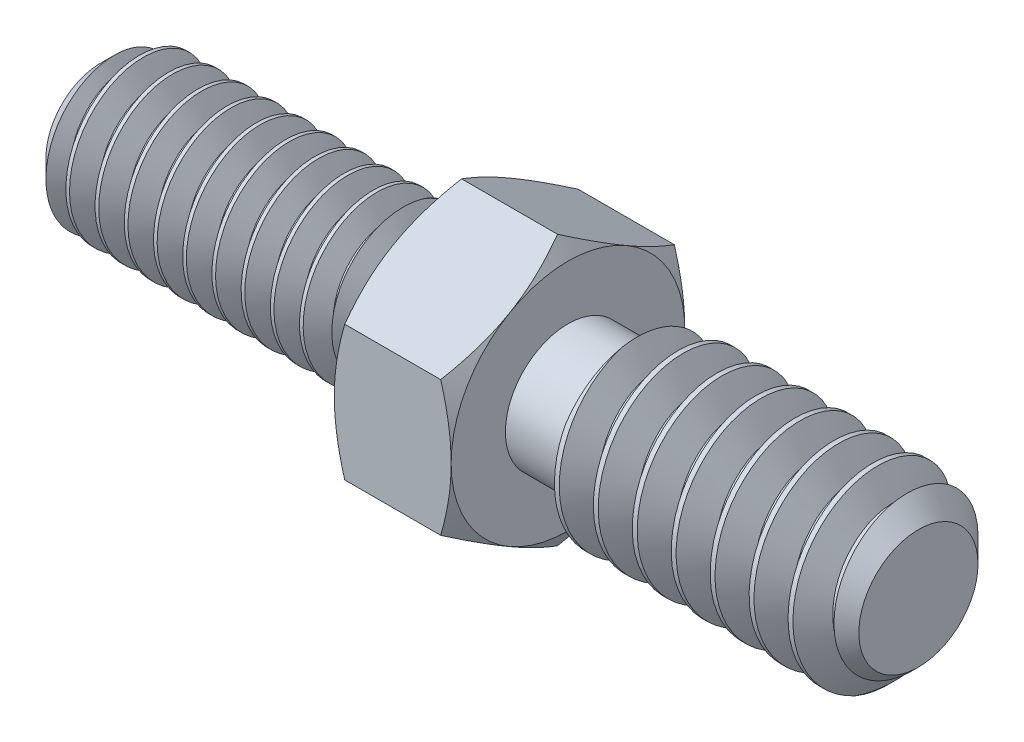
from build123d import *

# Parameters (mm, degrees)
SKETCH2_R           = 2.0828
EXTRUDE1_DEPTH      = 11.1125
CHAMFER1_SIZE       = 0.5953125
CUT_SWEEP3_PITCH    = 0.79375
SKETCH11_W          = 2.74240625
SKETCH11_H          = 0.566355748
SKETCH19_OUTSIDE_W  = 42.884
SKETCH19_OUTSIDE_H  = 42.884
SKETCH19_OUTSIDE_R  = 1.516444252
EXTRUDE10_DEPTH     = 9.873251015
EXTRUDE10_DRAFT     = -60
SKETCH3_R           = 2.413
EXTRUDE2_DEPTH      = 11.1125
CHAMFER2_SIZE       = 0.79375
CUT_SWEEP2_PITCH    = 1.058333333
SKETCH12_W          = 3.127375
SKETCH12_H          = 0.712807664
SKETCH18_OUTSIDE_W  = 65.666
SKETCH18_OUTSIDE_H  = 65.666
SKETCH18_OUTSIDE_R  = 1.700192336
EXTRUDE9_DEPTH      = 15.643059183
EXTRUDE9_DRAFT      = -60
EXTRUDE3_DEPTH      = 1.5875
EXTRUDE3_DEPTH_BACK = 1.5875
SKETCH13_OUTSIDE_W  = 63.756
SKETCH13_OUTSIDE_H  = 64.738
SKETCH13_OUTSIDE_R  = 3.175
EXTRUDE4_DEPTH      = 14.594537906
EXTRUDE4_DRAFT      = -60
SKETCH14_OUTSIDE_W  = 63.756
SKETCH14_OUTSIDE_H  = 64.738
SKETCH14_OUTSIDE_R  = 3.175
EXTRUDE5_DEPTH      = 14.594537906
EXTRUDE5_DRAFT      = -60


with BuildPart() as part:
    # Sketch2 → Extrude1 (new body)
    with BuildSketch(Plane(origin=(0, 0, 0), x_dir=(0, 0, -1), z_dir=(1, 0, 0))):
        Circle(SKETCH2_R)
    extrude(amount=-EXTRUDE1_DEPTH)

    # Chamfer1
    chamfer1_edges = [part.edges().sort_by_distance(p)[0] for p in [
        (-11.1125, 0, 2.0828),
    ]]
    chamfer(chamfer1_edges, length=CHAMFER1_SIZE)

    # Cut-Sweep3: arcs per turn and ends read off the stored shape
    # Cut-Sweep3: the profile of Sketch9 profile screwed along a right-hand helix through 16 turns, 8 arcs to a turn; built about Z, then put on its axis
    cut_sweep3_z = Axis((0, 0, 0), (0, 0, 1))
    cut_sweep3_corners = [(2.0831, 0, -0.54587633), (2.0831, 0, 0.14900133), (1.567244252, 0, -0.148828125), (1.567244252, 0, -0.248046875)]
    with BuildLine(mode=Mode.PRIVATE) as cut_sweep3_profile:
        Line(cut_sweep3_corners[0], cut_sweep3_corners[1])
        Line(cut_sweep3_corners[1], cut_sweep3_corners[2])
        Line(cut_sweep3_corners[2], cut_sweep3_corners[3])
        Line(cut_sweep3_corners[3], cut_sweep3_corners[0])
    cut_sweep3_cap = Face(cut_sweep3_profile.wire())
    cut_sweep3_turn_angles = [0, 22.5, 45, 67.5, 90, 112.5, 135, 157.5, 180, 202.5, 225, 247.5, 270, 292.5, 315, 337.5, 360]
    cut_sweep3_turn_weights = [1, 0.9238795325112867, 1, 0.9238795325112867, 1, 0.9238795325112867, 1, 0.9238795325112867, 1, 0.9238795325112867, 1, 0.9238795325112867, 1, 0.9238795325112867, 1, 0.9238795325112867, 1]
    cut_sweep3_turn_rails = [Edge.make_bspline([Vector(p[0], p[1], 0).rotate(cut_sweep3_z, cut_sweep3_turn_angles[k]) / cut_sweep3_turn_weights[k] + Vector(0, 0, p[2] + CUT_SWEEP3_PITCH * cut_sweep3_turn_angles[k] / 360) for k in range(17)], [0, 0, 0, 1, 1, 2, 2, 3, 3, 4, 4, 5, 5, 6, 6, 7, 7, 8, 8, 8], 2, cut_sweep3_turn_weights) for p in cut_sweep3_corners]
    cut_sweep3_turn_sides = [Face.make_surface_from_curves(cut_sweep3_turn_rails[p[0]], cut_sweep3_turn_rails[p[1]]) for p in [(0, 1), (1, 2), (2, 3), (3, 0)]]
    cut_sweep3 = Plane(origin=(-11.1125, 0, 0), x_dir=(0, 1, 0), z_dir=(1, 0, 0)) * Solid(Shell([*[p.moved(Location((0, 0, CUT_SWEEP3_PITCH * i))) for i in range(16) for p in cut_sweep3_turn_sides], cut_sweep3_cap, cut_sweep3_cap.rotate(cut_sweep3_z, 5760).moved(Location((0, 0, CUT_SWEEP3_PITCH * 5760 / 360)))]))
    add(cut_sweep3, mode=Mode.SUBTRACT)

    # Sketch11 → Cut-Revolve1 (revolve, cut)
    with BuildSketch(Plane.XY, mode=Mode.PRIVATE) as cut_revolve1_sk:
        with Locations((-1.371203125, 1.799622126)):
            Rectangle(SKETCH11_W, SKETCH11_H)
    revolve(cut_revolve1_sk.sketch.rotate(Axis((0.044535271, 0, 0), (-1, 0, 0)), 90), axis=Axis((0.044535271, 0, 0), (-1, 0, 0)), mode=Mode.SUBTRACT)


with BuildPart() as extrude10_tool:
    # Sketch19 outside → Extrude10 (with draft: the straight prism first)
    with BuildSketch(Plane(origin=(-2.74240625, 0, 0), x_dir=(0, 0, -1), z_dir=(1, 0, 0))):
        Rectangle(SKETCH19_OUTSIDE_W, SKETCH19_OUTSIDE_H)
        Circle(SKETCH19_OUTSIDE_R, mode=Mode.SUBTRACT)
    extrude(amount=-EXTRUDE10_DEPTH)
    # Extrude10: the draft: its side faces are tilted about the plane it starts from
    extrude10_sides = [extrude10_tool.faces().sort_by_distance(p)[0] for p in [
        (-7.679031757, -21.442, 0),
        (-7.679031757, 0, -21.442),
        (-7.679031757, 21.442, 0),
        (-7.679031757, 0, 21.442),
        (-7.679031757, 0, 1.516444252),
    ]]
    draft(extrude10_sides, Plane(origin=(-2.74240625, 0, 0), x_dir=(0, 0, -1), z_dir=(1, 0, 0)), EXTRUDE10_DRAFT)


with BuildPart() as part_1:
    add(part.part)

    # Extrude10: cut by extrude10_tool
    add(extrude10_tool.part, mode=Mode.SUBTRACT)



with BuildPart() as body_2:
    # Sketch3 → Extrude2 (new body)
    with BuildSketch(Plane(origin=(0, 0, 0), x_dir=(0, 0, -1), z_dir=(1, 0, 0))):
        Circle(SKETCH3_R)
    extrude(amount=EXTRUDE2_DEPTH)

    # Chamfer2
    chamfer2_edges = [body_2.edges().sort_by_distance(p)[0] for p in [
        (11.1125, 0, 2.413),
    ]]
    chamfer(chamfer2_edges, length=CHAMFER2_SIZE)

    # Cut-Sweep2: arcs per turn and ends read off the stored shape
    # Cut-Sweep2: the profile of Sketch10 profile screwed along a right-hand helix through 12 turns, 8 arcs to a turn; built about Z, then put on its axis
    cut_sweep2_z = Axis((0, 0, 0), (0, 0, 1))
    cut_sweep2_corners = [(2.4133, 0, 0.198610705), (2.4133, 0, -0.727777372), (1.725592336, 0, -0.330729167), (1.725592336, 0, -0.1984375)]
    with BuildLine(mode=Mode.PRIVATE) as cut_sweep2_profile:
        Line(cut_sweep2_corners[0], cut_sweep2_corners[1])
        Line(cut_sweep2_corners[1], cut_sweep2_corners[2])
        Line(cut_sweep2_corners[2], cut_sweep2_corners[3])
        Line(cut_sweep2_corners[3], cut_sweep2_corners[0])
    cut_sweep2_cap = Face(cut_sweep2_profile.wire())
    cut_sweep2_turn_angles = [0, 22.5, 45, 67.5, 90, 112.5, 135, 157.5, 180, 202.5, 225, 247.5, 270, 292.5, 315, 337.5, 360]
    cut_sweep2_turn_weights = [1, 0.9238795325112867, 1, 0.9238795325112867, 1, 0.9238795325112867, 1, 0.9238795325112867, 1, 0.9238795325112867, 1, 0.9238795325112867, 1, 0.9238795325112867, 1, 0.9238795325112867, 1]
    cut_sweep2_turn_rails = [Edge.make_bspline([Vector(p[0], p[1], 0).rotate(cut_sweep2_z, cut_sweep2_turn_angles[k]) / cut_sweep2_turn_weights[k] + Vector(0, 0, p[2] + CUT_SWEEP2_PITCH * cut_sweep2_turn_angles[k] / 360) for k in range(17)], [0, 0, 0, 1, 1, 2, 2, 3, 3, 4, 4, 5, 5, 6, 6, 7, 7, 8, 8, 8], 2, cut_sweep2_turn_weights) for p in cut_sweep2_corners]
    cut_sweep2_turn_sides = [Face.make_surface_from_curves(cut_sweep2_turn_rails[p[0]], cut_sweep2_turn_rails[p[1]]) for p in [(0, 1), (1, 2), (2, 3), (3, 0)]]
    cut_sweep2 = Plane(origin=(11.1125, 0, 0), x_dir=(0, 1, 0), z_dir=(-1, 0, 0)) * Solid(Shell([*[p.moved(Location((0, 0, CUT_SWEEP2_PITCH * i))) for i in range(12) for p in cut_sweep2_turn_sides], cut_sweep2_cap, cut_sweep2_cap.rotate(cut_sweep2_z, 4320).moved(Location((0, 0, CUT_SWEEP2_PITCH * 4320 / 360)))]))
    add(cut_sweep2, mode=Mode.SUBTRACT)

    # Sketch12 → Cut-Revolve2 (revolve, cut)
    with BuildSketch(Plane.XY, mode=Mode.PRIVATE) as cut_revolve2_sk:
        with Locations((1.5636875, 2.056596168)):
            Rectangle(SKETCH12_W, SKETCH12_H)
    revolve(cut_revolve2_sk.sketch.rotate(Axis((-11.1125, 0, 0), (1, 0, 0)), 157.5), axis=Axis((-11.1125, 0, 0), (1, 0, 0)), mode=Mode.SUBTRACT)


with BuildPart() as extrude9_tool:
    # Sketch18 outside → Extrude9 (with draft: the straight prism first)
    with BuildSketch(Plane.ZY.offset(-3.127375)):
        Rectangle(SKETCH18_OUTSIDE_W, SKETCH18_OUTSIDE_H)
        Circle(SKETCH18_OUTSIDE_R, mode=Mode.SUBTRACT)
    extrude(amount=-EXTRUDE9_DEPTH)
    # Extrude9: the draft: its side faces are tilted about the plane it starts from
    extrude9_sides = [extrude9_tool.faces().sort_by_distance(p)[0] for p in [
        (10.948904592, -32.833, 0),
        (10.948904592, 0, 32.833),
        (10.948904592, 32.833, 0),
        (10.948904592, 0, -32.833),
        (10.948904592, 0, -1.700192336),
    ]]
    draft(extrude9_sides, Plane.ZY.offset(-3.127375), EXTRUDE9_DRAFT)


with BuildPart() as body_2_1:
    add(body_2.part)

    # Extrude9: cut by extrude9_tool
    add(extrude9_tool.part, mode=Mode.SUBTRACT)


with BuildPart() as part_2:
    add(part_1.part)

    add(body_2_1.part)  # Extrude3 merges body 2
    # Sketch6 → Extrude3 (add, two sides: drawn at the far end of the back side and taken through both)
    with BuildSketch(Plane(origin=(0, 0, 0), x_dir=(0, 0, -1), z_dir=(1, 0, 0)).offset(-EXTRUDE3_DEPTH_BACK)):
        Polygon((0, 3.666174209), (-3.175, 1.833087105), (-3.175, -1.833087105), (0, -3.666174209), (3.175, -1.833087105), (3.175, 1.833087105), align=None)
    extrude(amount=EXTRUDE3_DEPTH + EXTRUDE3_DEPTH_BACK)


with BuildPart() as extrude4_tool:
    # Sketch13 outside → Extrude4 (with draft: the straight prism first)
    with BuildSketch(Plane.ZY.offset(1.5875)):
        Rectangle(SKETCH13_OUTSIDE_W, SKETCH13_OUTSIDE_H)
        Circle(SKETCH13_OUTSIDE_R, mode=Mode.SUBTRACT)
    extrude(amount=-EXTRUDE4_DEPTH)
    # Extrude4: the draft: its side faces are tilted about the plane it starts from
    extrude4_sides = [extrude4_tool.faces().sort_by_distance(p)[0] for p in [
        (5.709768953, -32.369, 0),
        (5.709768953, 0, 31.878),
        (5.709768953, 32.369, 0),
        (5.709768953, 0, -31.878),
        (5.709768953, 0, -3.175),
    ]]
    draft(extrude4_sides, Plane.ZY.offset(1.5875), EXTRUDE4_DRAFT)


with BuildPart() as part_3:
    add(part_2.part)

    # Extrude4: cut by extrude4_tool
    add(extrude4_tool.part, mode=Mode.SUBTRACT)


with BuildPart() as extrude5_tool:
    # Sketch14 outside → Extrude5 (with draft: the straight prism first)
    with BuildSketch(Plane(origin=(1.5875, 0, 0), x_dir=(0, 0, -1), z_dir=(1, 0, 0))):
        Rectangle(SKETCH14_OUTSIDE_W, SKETCH14_OUTSIDE_H)
        Circle(SKETCH14_OUTSIDE_R, mode=Mode.SUBTRACT)
    extrude(amount=-EXTRUDE5_DEPTH)
    # Extrude5: the draft: its side faces are tilted about the plane it starts from
    extrude5_sides = [extrude5_tool.faces().sort_by_distance(p)[0] for p in [
        (-5.709768953, -32.369, 0),
        (-5.709768953, 0, -31.878),
        (-5.709768953, 32.369, 0),
        (-5.709768953, 0, 31.878),
        (-5.709768953, 0, 3.175),
    ]]
    draft(extrude5_sides, Plane(origin=(1.5875, 0, 0), x_dir=(0, 0, -1), z_dir=(1, 0, 0)), EXTRUDE5_DRAFT)


with BuildPart() as part_4:
    add(part_3.part)

    # Extrude5: cut by extrude5_tool
    add(extrude5_tool.part, mode=Mode.SUBTRACT)


solid = part_4.part
